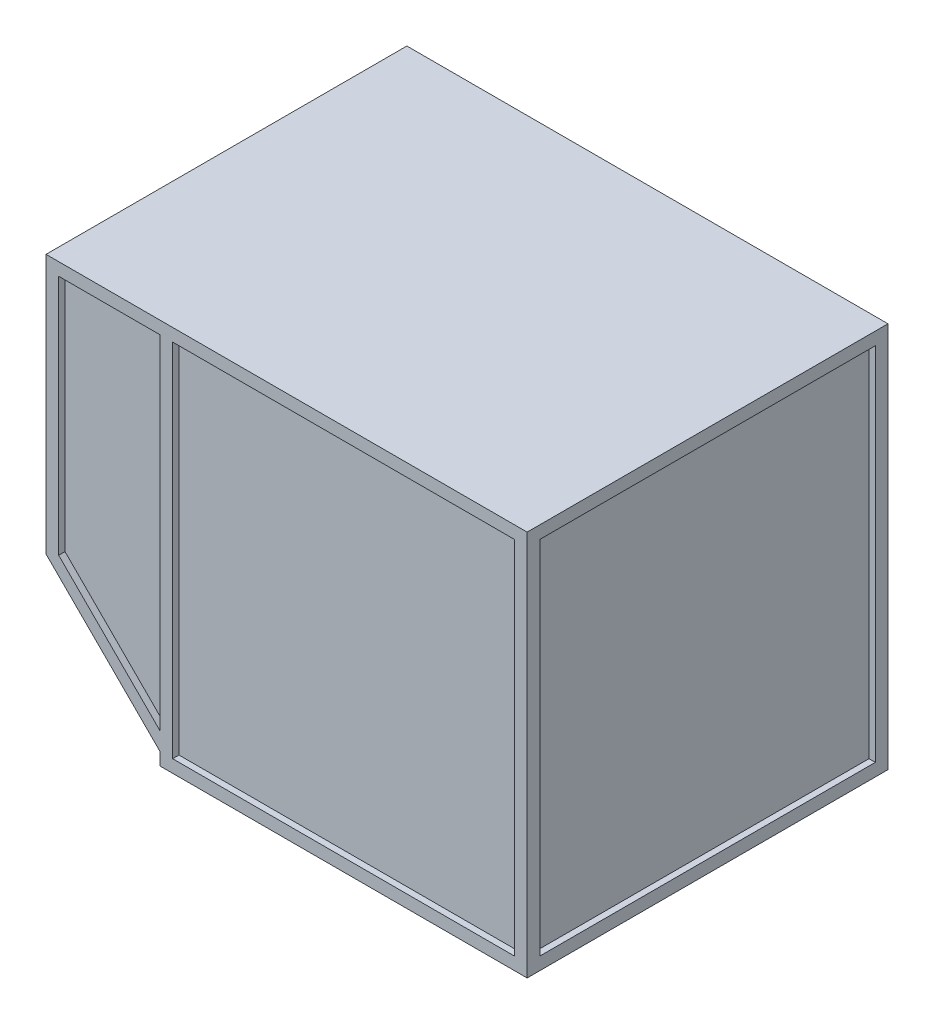
from build123d import *

# Parameters (mm, degrees)
SKETCH1_W              = 1930.4
SKETCH1_H              = 1447.8
BOSS_EXTRUDE1_DEPTH    = 1549.4
CUT_EXTRUDE1_DEPTH     = 1447.8
CUT_EXTRUDE2_DEPTH     = 25.4
CUT_EXTRUDE3_START     = -1447.8
CUT_EXTRUDE3_OUTLINE_W = 1371.6
CUT_EXTRUDE3_OUTLINE_H = 1447.8
CUT_EXTRUDE3_DEPTH     = 25.4
SKETCH4_W              = 1346.2
SKETCH4_H              = 939.8
CUT_EXTRUDE4_DEPTH     = 25.4
SKETCH5_W              = 1346.2
SKETCH5_H              = 1447.8
CUT_EXTRUDE5_DEPTH     = 25.4


# Read off the part's stored shape, not the designer's step: Cut-Extrude3
with BuildPart() as part:
    # Sketch1 → Boss-Extrude1 (new body)
    with BuildSketch(Plane(origin=(0, 0, 0), x_dir=(1, 0, 0), z_dir=(0, 1, 0))):
        Rectangle(SKETCH1_W, SKETCH1_H)
    extrude(amount=BOSS_EXTRUDE1_DEPTH)

    # Sketch2 → Cut-Extrude1 (cut)
    with BuildSketch(Plane.XY.offset(723.9)):
        Polygon((-965.2, 0), (-508, 0), (-508, 50.8), (-965.2, 508), align=None)
    extrude(amount=-CUT_EXTRUDE1_DEPTH, mode=Mode.SUBTRACT)

    # Sketch3 → Cut-Extrude2 (cut)
    with BuildSketch(Plane.XY.offset(723.9)):
        Polygon((-914.4, 1498.6), (-914.4, 529.042048969), (-508, 122.642048969), (-508, 1498.6), align=None)
        Polygon((-457.2, 71.842048969), (-457.2, 50.8), (914.4, 50.8), (914.4, 1498.6), (-457.2, 1498.6), align=None)
    extrude(amount=-CUT_EXTRUDE2_DEPTH, mode=Mode.SUBTRACT)

    # Cut-Extrude3 outline → Cut-Extrude3 (cut)
    with BuildSketch(Plane.XY.offset(723.9).offset(CUT_EXTRUDE3_START)):
        Polygon((-508, 122.642048969), (-508, 1498.6), (-914.4, 1498.6), (-914.4, 529.042048969), align=None)
        with Locations((228.6, 774.7)):
            Rectangle(CUT_EXTRUDE3_OUTLINE_W, CUT_EXTRUDE3_OUTLINE_H)
    extrude(amount=CUT_EXTRUDE3_DEPTH, mode=Mode.SUBTRACT)

    # Sketch4 → Cut-Extrude4 (cut)
    with BuildSketch(Plane.ZY.offset(965.2)):
        with Locations((0, 1028.7)):
            Rectangle(SKETCH4_W, SKETCH4_H)
    extrude(amount=-CUT_EXTRUDE4_DEPTH, mode=Mode.SUBTRACT)

    # Sketch5 → Cut-Extrude5 (cut)
    with BuildSketch(Plane(origin=(965.2, 0, 0), x_dir=(0, 0, -1), z_dir=(1, 0, 0))):
        with Locations((0, 774.7)):
            Rectangle(SKETCH5_W, SKETCH5_H)
    extrude(amount=-CUT_EXTRUDE5_DEPTH, mode=Mode.SUBTRACT)


solid = part.part
